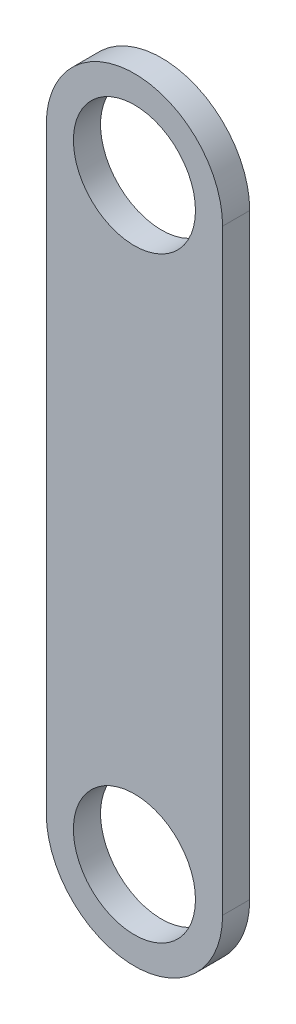
from build123d import *

# Parameters (mm, degrees)
SKETCH2_R           = 14.2875
BOSS_EXTRUDE1_DEPTH = 3.175


with BuildPart() as part:
    # Sketch2 → Boss-Extrude1 (new, symmetric)
    with BuildSketch(Plane.XY):
        with BuildLine():
            ThreePointArc((20.6375, 139.7), (0, 160.3375), (-20.6375, 139.7))
            Line((-20.6375, 139.7), (-20.6375, 0))
            ThreePointArc((-20.6375, 0), (0, -20.6375), (20.6375, 0))
            Line((20.6375, 0), (20.6375, 139.7))
        make_face()
        with Locations((0, 139.7)):
            Circle(SKETCH2_R, mode=Mode.SUBTRACT)
        Circle(SKETCH2_R, mode=Mode.SUBTRACT)
    extrude(amount=BOSS_EXTRUDE1_DEPTH, both=True)


solid = part.part
